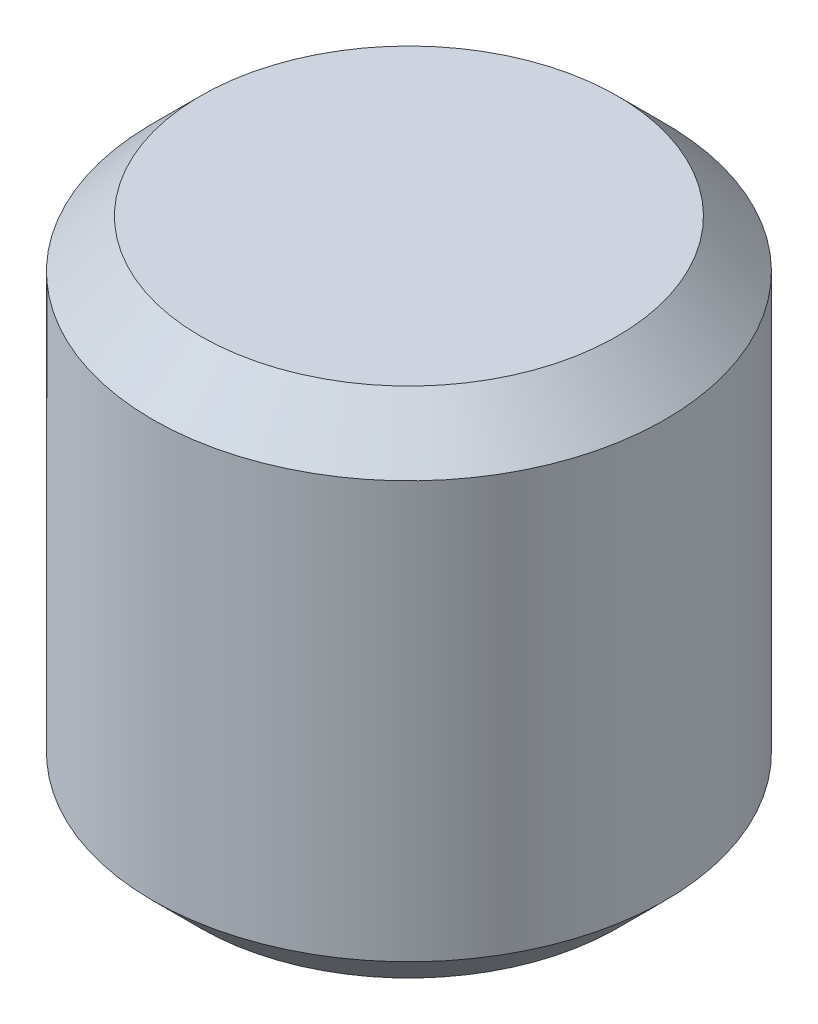
from build123d import *

# Parameters (mm, degrees)
SKETCH1_R           = 6.35
BOSS_EXTRUDE1_DEPTH = 12.7
CHAMFER1_SIZE       = 1.190625


with BuildPart() as part:
    # Sketch1 → Boss-Extrude1 (new body)
    with BuildSketch(Plane(origin=(0, 0, 0), x_dir=(1, 0, 0), z_dir=(0, 1, 0))):
        Circle(SKETCH1_R)
    extrude(amount=BOSS_EXTRUDE1_DEPTH)

    # Chamfer1
    chamfer1_edges = [part.edges().sort_by_distance(p)[0] for p in [
        (-6.35, 0, 0),
        (-6.35, 12.7, 0),
    ]]
    chamfer(chamfer1_edges, length=CHAMFER1_SIZE)


solid = part.part
